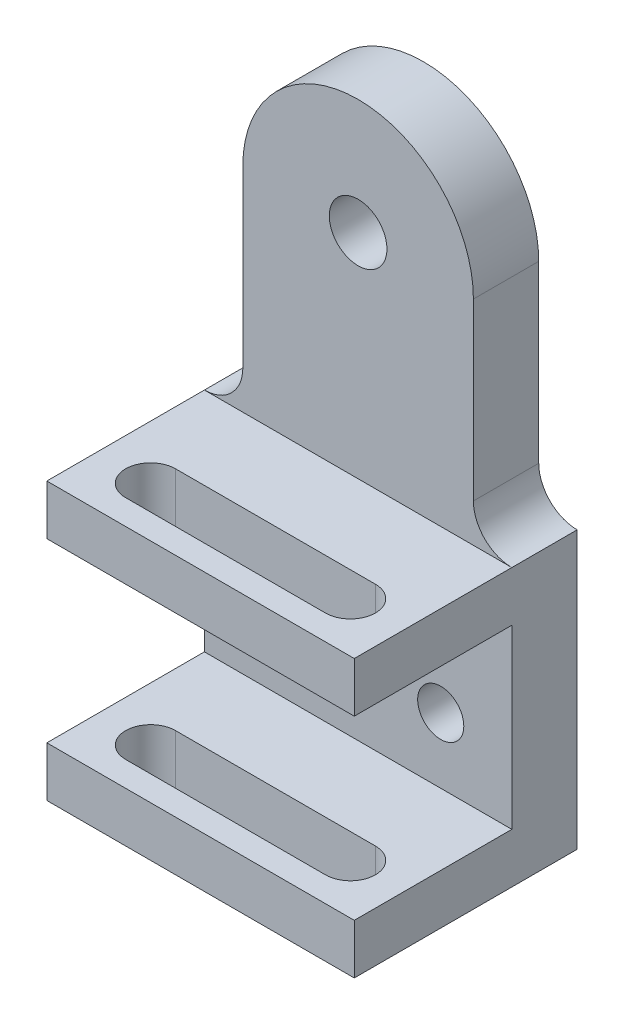
from build123d import *

# Parameters (mm, degrees)
SKETCH1_W           = 80
SKETCH1_H           = 58
BOSS_EXTRUDE1_DEPTH = 13
SKETCH2_W           = 80
SKETCH2_H           = 17
BOSS_EXTRUDE2_DEPTH = 59
SKETCH3_W           = 80
SKETCH3_H           = 13
BOSS_EXTRUDE3_DEPTH = 41
SKETCH4_W           = 80
SKETCH4_H           = 17
BOSS_EXTRUDE4_DEPTH = 55.5
SKETCH5_W           = 10
SKETCH5_H           = 55.5
CUT_EXTRUDE1_DEPTH  = 55.5
SKETCH7_W           = 10
SKETCH7_H           = 55.5
CUT_EXTRUDE2_DEPTH  = 55.5
SKETCH8_R           = 30
BOSS_EXTRUDE5_DEPTH = 17
SKETCH9_R           = 7.5
CUT_EXTRUDE3_DEPTH  = 17
FILLET1_R           = 10
FILLET2_R           = 10
CUT_EXTRUDE4_DEPTH  = 17
CUT_EXTRUDE5_DEPTH  = 17
SKETCH12_R          = 6
CUT_EXTRUDE6_DEPTH  = 17
SKETCH13_R          = 6
CUT_EXTRUDE7_DEPTH  = 17


with BuildPart() as part:
    # Sketch1 → Boss-Extrude1 (new body)
    with BuildSketch(Plane(origin=(0, 0, 0), x_dir=(1, 0, 0), z_dir=(0, 1, 0))):
        Rectangle(SKETCH1_W, SKETCH1_H)
    extrude(amount=BOSS_EXTRUDE1_DEPTH)

    # Sketch2 → Boss-Extrude2 (add)
    with BuildSketch(Plane(origin=(0, 13, 0), x_dir=(1, 0, 0), z_dir=(0, 1, 0))):
        with Locations((0, 20.5)):
            Rectangle(SKETCH2_W, SKETCH2_H)
    extrude(amount=BOSS_EXTRUDE2_DEPTH)

    # Sketch3 → Boss-Extrude3 (add)
    with BuildSketch(Plane.XY.offset(-12)):
        with Locations((0, 65.5)):
            Rectangle(SKETCH3_W, SKETCH3_H)
    extrude(amount=BOSS_EXTRUDE3_DEPTH)

    # Sketch4 → Boss-Extrude4 (add)
    with BuildSketch(Plane(origin=(0, 72, 0), x_dir=(1, 0, 0), z_dir=(0, 1, 0))):
        with Locations((0, 20.5)):
            Rectangle(SKETCH4_W, SKETCH4_H)
    extrude(amount=BOSS_EXTRUDE4_DEPTH)

    # Sketch5 → Cut-Extrude1 (cut)
    with BuildSketch(Plane.XY.offset(-12)):
        with Locations((-35, 99.75)):
            Rectangle(SKETCH5_W, SKETCH5_H)
    extrude(amount=-CUT_EXTRUDE1_DEPTH, mode=Mode.SUBTRACT)

    # Sketch7 → Cut-Extrude2 (cut)
    with BuildSketch(Plane.XY.offset(-12)):
        with Locations((35, 99.75)):
            Rectangle(SKETCH7_W, SKETCH7_H)
    extrude(amount=-CUT_EXTRUDE2_DEPTH, mode=Mode.SUBTRACT)

    # Sketch8 → Boss-Extrude5 (add)
    with BuildSketch(Plane.XY.offset(-12)):
        with Locations((0, 127.5)):
            Circle(SKETCH8_R)
    extrude(amount=-BOSS_EXTRUDE5_DEPTH)

    # Sketch9 → Cut-Extrude3 (cut)
    with BuildSketch(Plane.XY.offset(-12)):
        with Locations((0, 127.5)):
            Circle(SKETCH9_R)
    extrude(amount=-CUT_EXTRUDE3_DEPTH, mode=Mode.SUBTRACT)

    # Fillet1
    fillet1_edges = [part.edges().sort_by_distance(p)[0] for p in [
        (-30, 72, -20.5),
    ]]
    fillet(fillet1_edges, radius=FILLET1_R - 0.0001)  # a hair under: the kernel refuses the full size

    # Fillet2
    fillet2_edges = [part.edges().sort_by_distance(p)[0] for p in [
        (30, 72, -20.5),
    ]]
    fillet(fillet2_edges, radius=FILLET2_R - 0.0001)  # a hair under: the kernel refuses the full size

    # Sketch10 → Cut-Extrude4 (cut)
    with BuildSketch(Plane(origin=(0, 13, 0), x_dir=(1, 0, 0), z_dir=(0, 1, 0))):
        with BuildLine():
            Line((-26, -9.5), (26, -9.5))
            ThreePointArc((26, -9.5), (32.5, -16), (26, -22.5))
            Line((26, -22.5), (-26, -22.5))
            ThreePointArc((-26, -22.5), (-32.5, -16), (-26, -9.5))
        make_face()
    extrude(amount=-CUT_EXTRUDE4_DEPTH, mode=Mode.SUBTRACT)

    # Sketch11 → Cut-Extrude5 (cut)
    with BuildSketch(Plane(origin=(0, 72, 0), x_dir=(1, 0, 0), z_dir=(0, 1, 0))):
        with BuildLine():
            Line((-26, -9.5), (26, -9.5))
            ThreePointArc((26, -9.5), (32.5, -16), (26, -22.5))
            Line((26, -22.5), (-26, -22.5))
            ThreePointArc((-26, -22.5), (-32.5, -16), (-26, -9.5))
        make_face()
    extrude(amount=-CUT_EXTRUDE5_DEPTH, mode=Mode.SUBTRACT)

    # Sketch12 → Cut-Extrude6 (cut)
    with BuildSketch(Plane.XY.offset(-12)):
        with Locations((-21.5, 30)):
            Circle(SKETCH12_R)
    extrude(amount=-CUT_EXTRUDE6_DEPTH, mode=Mode.SUBTRACT)

    # Sketch13 → Cut-Extrude7 (cut)
    with BuildSketch(Plane.XY.offset(-12)):
        with Locations((21.5, 30)):
            Circle(SKETCH13_R)
    extrude(amount=-CUT_EXTRUDE7_DEPTH, mode=Mode.SUBTRACT)


solid = part.part
